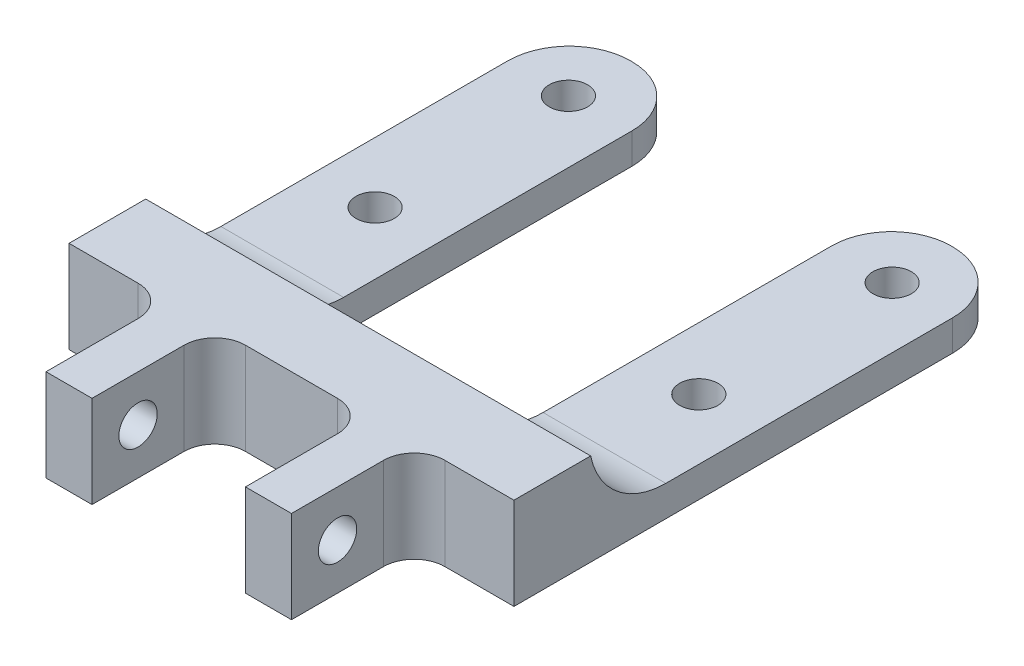
from build123d import *

# Parameters (mm, degrees)
SKETCH1_R                = 1.25
BOSS_EXTRUDE1_DEPTH      = 2
BOSS_EXTRUDE2_DEPTH      = 4
BOSS_EXTRUDE2_DEPTH_BACK = 2
SKETCH2_W                = 29
SKETCH2_H                = 5
FILLET1_R                = 5
SKETCH3_W                = 3
SKETCH3_H                = 6
BOSS_EXTRUDE3_DEPTH      = 8
FILLET2_R                = 2
CUT_EXTRUDE1_DEPTH       = 15
CUT_EXTRUDE1_DEPTH_BACK  = 7
SKETCH4_R                = 1.25


with BuildPart() as part:
    # Sketch1 → Boss-Extrude1 (new body)
    with BuildSketch(Plane(origin=(0, 0, 0), x_dir=(1, 0, 0), z_dir=(0, 1, 0))):
        with BuildLine():
            Line((24.9, 27.6), (25, 27.6))
            ThreePointArc((25, 27.6), (27.828427125, 26.428427125), (29, 23.6))
            Line((29, 23.6), (29, 0))
            Line((29, 0), (0, 0))
            Line((0, 0), (0, 23.6))
            ThreePointArc((0, 23.6), (1.171572875, 26.428427125), (4, 27.6))
            Line((4, 27.6), (4.1, 27.6))
            ThreePointArc((4.1, 27.6), (6.857716447, 26.457716447), (8, 23.7))
            Line((8, 23.7), (8, 3.5))
            Line((8, 3.5), (21, 3.5))
            Line((21, 3.5), (21, 23.7))
            ThreePointArc((21, 23.7), (22.142283553, 26.457716447), (24.9, 27.6))
        make_face()
        with Locations(Location((3.95, 23.6, 0), (0, 0, 270))):
            Circle(SKETCH1_R, mode=Mode.SUBTRACT)
        with Locations(Location((25.05, 23.6, 0), (0, 0, 270))):
            Circle(SKETCH1_R, mode=Mode.SUBTRACT)
        with Locations(Location((25.05, 11, 0), (0, 0, 270))):
            Circle(SKETCH1_R, mode=Mode.SUBTRACT)
        with Locations(Location((3.95, 11, 0), (0, 0, 270))):
            Circle(SKETCH1_R, mode=Mode.SUBTRACT)
    extrude(amount=BOSS_EXTRUDE1_DEPTH)

    # Sketch2 → Boss-Extrude2 (add, two sides: drawn at the far end of the back side and taken through both)
    with BuildSketch(Plane(origin=(0, 2, 0), x_dir=(1, 0, 0), z_dir=(0, 1, 0)).offset(-BOSS_EXTRUDE2_DEPTH_BACK)):
        with Locations((14.5, -2.5)):
            Rectangle(SKETCH2_W, SKETCH2_H)
    extrude(amount=BOSS_EXTRUDE2_DEPTH + BOSS_EXTRUDE2_DEPTH_BACK)

    # Fillet1
    # the kernel refuses this fillet: 5 mm, written as the material it adds along each edge
    with BuildSketch(Plane(origin=(29, 2, 0), x_dir=(0, 0, -1), z_dir=(-1, 0, 0))) as fillet1_piece_1_section:
        with BuildLine():
            CenterArc((4.898979486, -5), FILLET1_R, 90, 78.463040967)
            Line((0, -4), (0, 0))
            Line((0, 0), (4.898979486, 0))
        make_face()
    fillet1_piece_1 = extrude(amount=41.247448714, mode=Mode.PRIVATE)
    fillet1_piece_1 = split(fillet1_piece_1, bisect_by=Plane(origin=(21, 2, 0), z_dir=(1, 0, 0)), keep=Keep.TOP, mode=Mode.PRIVATE)
    add(fillet1_piece_1)
    with BuildSketch(Plane(origin=(41.247448714, 2, 0), x_dir=(0, 0, -1), z_dir=(-1, 0, 0))) as fillet1_piece_2_section:
        with BuildLine():
            CenterArc((4.898979486, -5), FILLET1_R, 90, 78.463040967)
            Line((0, -4), (0, 0))
            Line((0, 0), (4.898979486, 0))
        make_face()
    fillet1_piece_2 = extrude(amount=41.247448714, mode=Mode.PRIVATE)
    fillet1_piece_2 = split(fillet1_piece_2, bisect_by=Plane(origin=(21, 2, 0), z_dir=(-1, 0, 0)), keep=Keep.TOP, mode=Mode.PRIVATE)
    fillet1_piece_2 = split(fillet1_piece_2, bisect_by=Plane(origin=(41.247448714, 2, -3.5), z_dir=(0, 0, 1)), keep=Keep.TOP, mode=Mode.PRIVATE)
    add(fillet1_piece_2)
    with BuildSketch(Plane(origin=(41.247448714, 2, 0), x_dir=(0, 0, -1), z_dir=(-1, 0, 0))) as fillet1_piece_3_section:
        with BuildLine():
            CenterArc((4.898979486, -5), FILLET1_R, 90, 78.463040967)
            Line((0, -4), (0, 0))
            Line((0, 0), (4.898979486, 0))
        make_face()
    fillet1_piece_3 = extrude(amount=41.247448714, mode=Mode.PRIVATE)
    fillet1_piece_3 = split(fillet1_piece_3, bisect_by=Plane(origin=(8, 2, 0), z_dir=(-1, 0, 0)), keep=Keep.TOP, mode=Mode.PRIVATE)
    add(fillet1_piece_3)

    # Sketch3 → Boss-Extrude3 (add)
    with BuildSketch(Plane.XY.offset(5)):
        with Locations((8, 3)):
            Rectangle(SKETCH3_W, SKETCH3_H)
        with Locations((21, 3)):
            Rectangle(SKETCH3_W, SKETCH3_H)
    extrude(amount=BOSS_EXTRUDE3_DEPTH)

    # Fillet2
    fillet2_edges = [part.edges().sort_by_distance(p)[0] for p in [
        (9.5, 3, 5),
        (6.5, 3, 5),
        (19.5, 3, 5),
        (22.5, 3, 5),
    ]]
    fillet(fillet2_edges, radius=FILLET2_R)

    # Sketch4 → Cut-Extrude1 (cut, two sides: drawn at the far end of the back side and taken through both)
    with BuildSketch(Plane(origin=(9.5, 0, 0), x_dir=(0, 0, -1), z_dir=(1, 0, 0)).offset(-CUT_EXTRUDE1_DEPTH_BACK)):
        with Locations(Location((-10, 3, 0), (0, 0, 180))):
            Circle(SKETCH4_R)
    extrude(amount=CUT_EXTRUDE1_DEPTH + CUT_EXTRUDE1_DEPTH_BACK, mode=Mode.SUBTRACT)


solid = part.part
